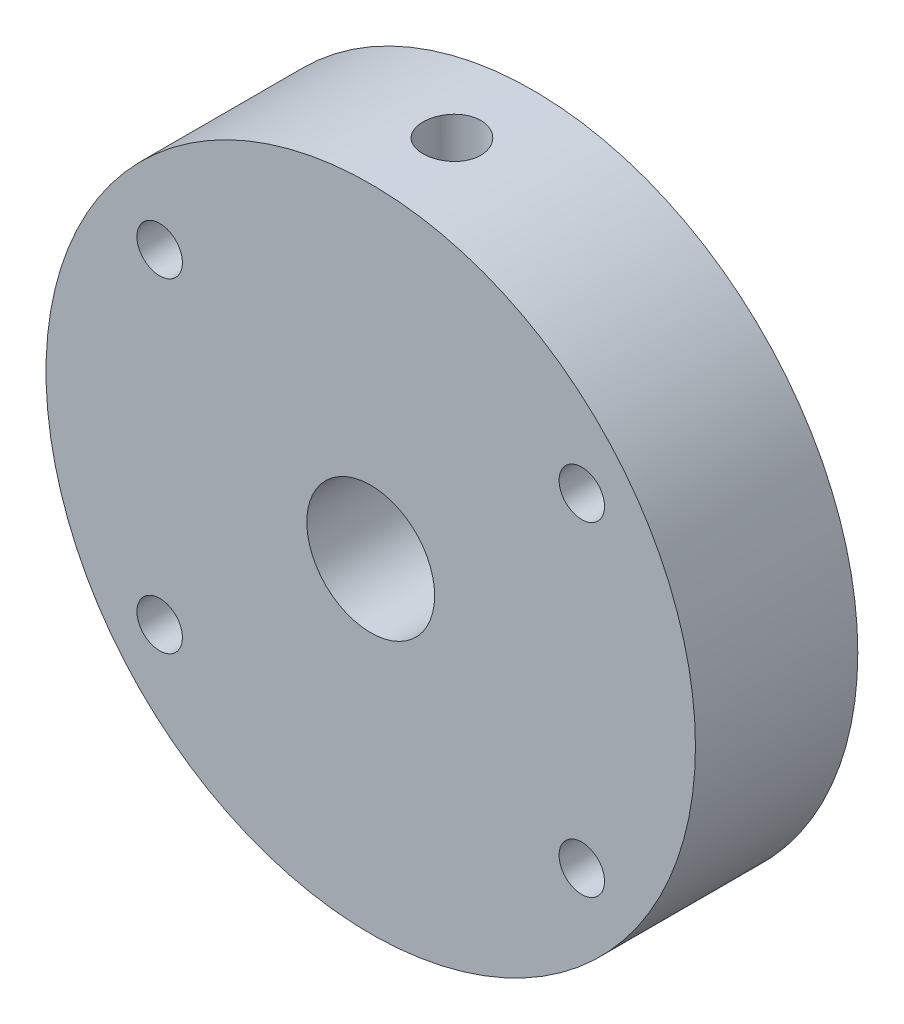
from build123d import *

# Parameters (mm, degrees)
SKETCH1_R             = 12.7
SKETCH1_R_2           = 2.5
BOSS_EXTRUDE1_DEPTH   = 6.35
F_2_56_TAPPED_HOLE1_D = 1.778
SKETCH6_W             = 1.1303
SKETCH6_H             = 12.7


with BuildPart() as part:
    # Sketch1 → Boss-Extrude1 (new body)
    with BuildSketch(Plane.XY):
        Circle(SKETCH1_R)
        Circle(SKETCH1_R_2, mode=Mode.SUBTRACT)
    extrude(amount=BOSS_EXTRUDE1_DEPTH)

    # #2-56 Tapped Hole1 (through all)
    with Locations(Plane.XY.offset(6.35)):
        with Locations((-8.255, 6.35), (8.255, 6.35), (8.255, -6.35), (-8.255, -6.35)):
            Hole(F_2_56_TAPPED_HOLE1_D / 2)

    # Sketch6 → #4-40 Tapped Hole1 (revolve, cut)
    with BuildSketch(Plane(origin=(0, 0, 3.175), x_dir=(0, 0, -1), z_dir=(1, 0, 0))):
        with Locations((0.56515, 6.35)):
            Rectangle(SKETCH6_W, SKETCH6_H)
    revolve(axis=Axis((0, -6.35, 3.175), (0, 1, 0)), mode=Mode.SUBTRACT)


solid = part.part
